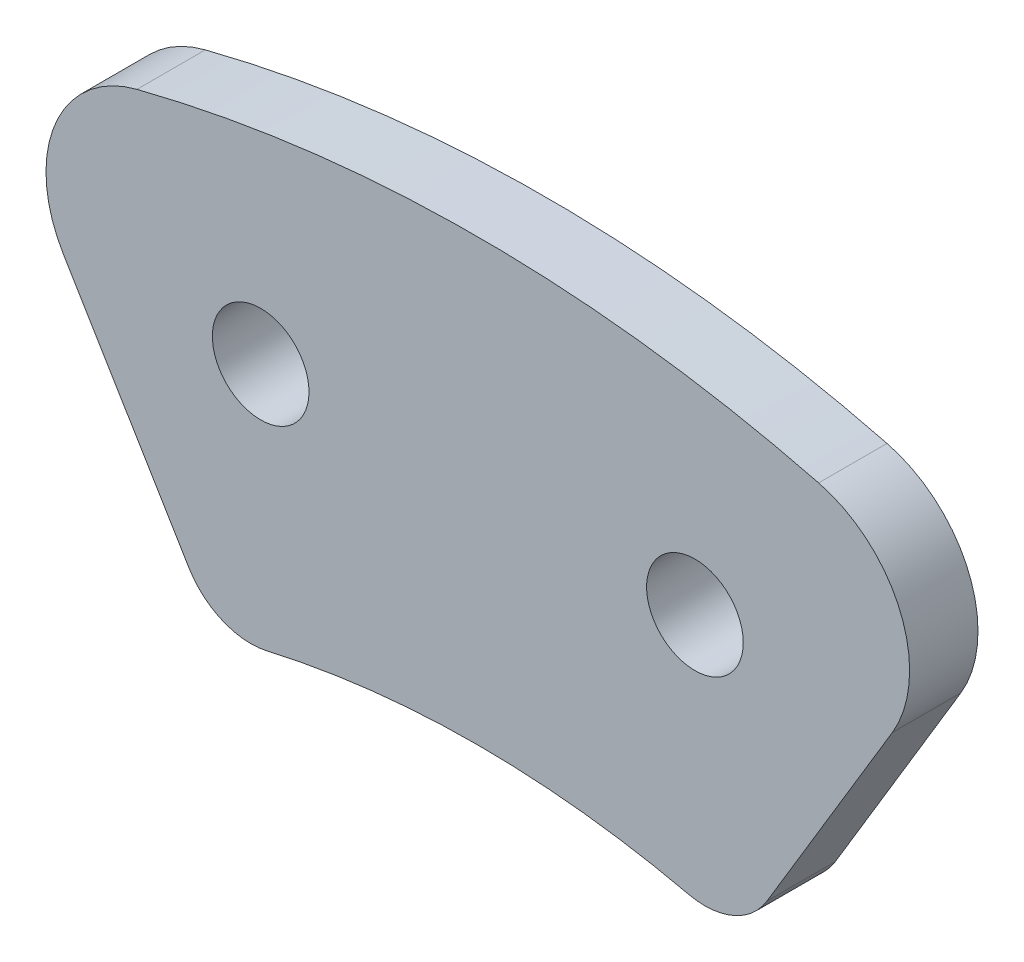
from build123d import *

# Parameters (mm, degrees)
SKETCH_2_R      = 1.06
EXTRUDE_1_DEPTH = 0.75
FILLET_1_R      = 2.65
FILLET_2_R      = 1.59


with BuildPart() as part:
    # 草图2 → 拉伸1 (new, symmetric)
    with BuildSketch(Plane.XY):
        with BuildLine():
            Line((5.730721037, 19.810931144), (8.300141741, 24.087165303))
            Line((8.300141741, 24.087165303), (10.818460752, 28.278351963))
            ThreePointArc((10.818460752, 28.278351963), (0, 30.277124745), (-10.818460752, 28.278351963))
            Line((-10.818460752, 28.278351963), (-5.730721037, 19.810931144))
            ThreePointArc((-5.730721037, 19.810931144), (0, 20.623146132), (5.730721037, 19.810931144))
        make_face()
        with Locations((-4.7625, 25.477124745)):
            Circle(SKETCH_2_R, mode=Mode.SUBTRACT)
        with Locations((4.7625, 25.477124745)):
            Circle(SKETCH_2_R, mode=Mode.SUBTRACT)
    extrude(amount=EXTRUDE_1_DEPTH, both=True)

    # 圆角1
    fillet_1_edges = [part.edges().sort_by_distance(p)[0] for p in [
        (10.818460752, 28.278351963, 0),
        (-10.818460752, 28.278351963, 0),
    ]]
    fillet(fillet_1_edges, radius=FILLET_1_R)

    # 圆角2
    fillet_2_edges = [part.edges().sort_by_distance(p)[0] for p in [
        (-5.730721037, 19.810931144, 0),
        (5.730721037, 19.810931144, 0),
    ]]
    fillet(fillet_2_edges, radius=FILLET_2_R)


solid = part.part
